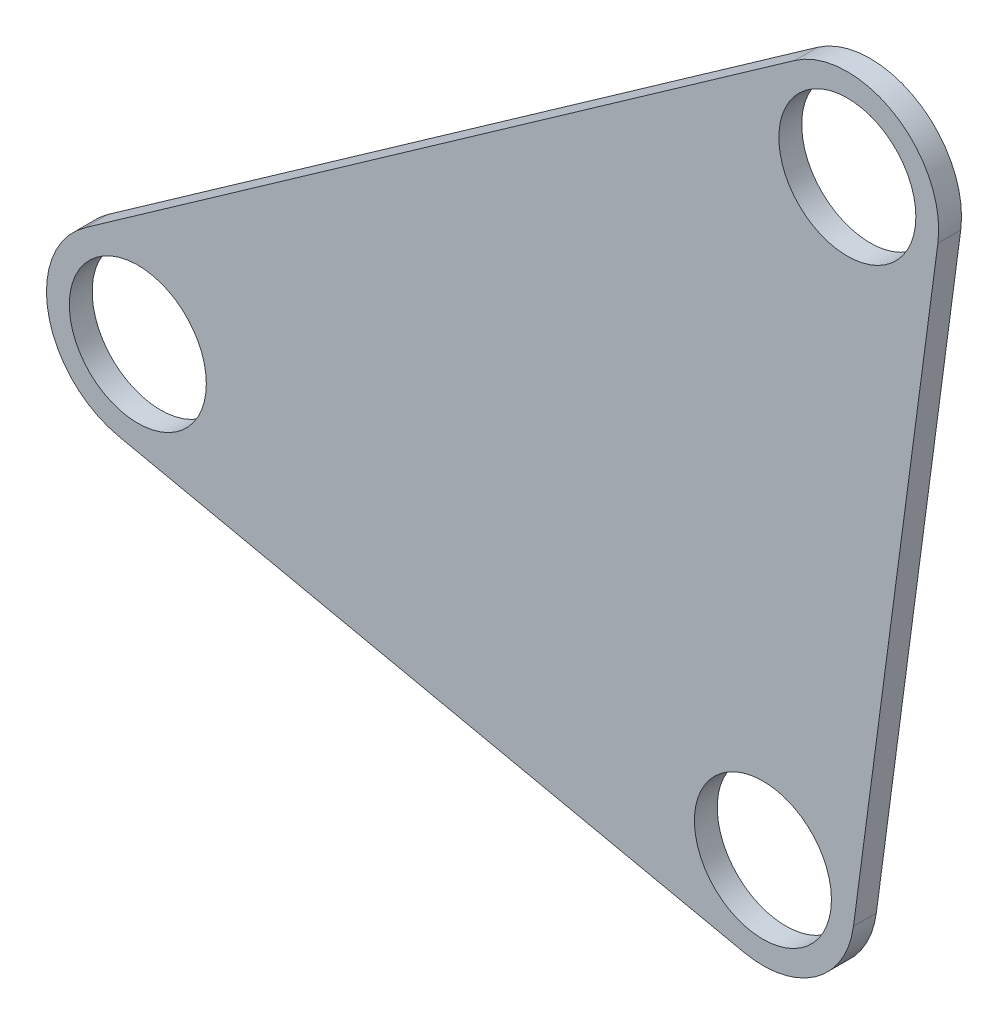
from build123d import *

# Parameters (mm, degrees)
ESQUISSE1_R               = 3
T_LE_DE_BASE_PLI_E1_DEPTH = 1


# Sheet-metal steps are written as plain solids
with BuildPart() as part:
    # Esquisse1 → Tôle de base pliée1 (new body)
    with BuildSketch(Plane.XY):
        with BuildLine():
            Line((-59.980728888, -3.900810235), (-32.6051263, -9.780978848))
            ThreePointArc((-32.6051263, -9.780978848), (-29.46250107, -9.14096248), (-27.800119432, -6.398299253))
            Line((-27.800119432, -6.398299253), (-24.103274011, 21.356580209))
            ThreePointArc((-24.103274011, 21.356580209), (-25.994902612, 25.305403023), (-30.370857933, 25.155484984))
            Line((-30.370857933, 25.155484984), (-61.443305942, 3.280774136))
            ThreePointArc((-61.443305942, 3.280774136), (-63.060247102, -0.788250523), (-59.980728888, -3.900810235))
        make_face()
        with Locations((-28.068256791, 21.884700983)):
            Circle(ESQUISSE1_R, mode=Mode.SUBTRACT)
        with Locations((-31.765102212, -5.870178479)):
            Circle(ESQUISSE1_R, mode=Mode.SUBTRACT)
        with Locations((-59.1407048, 0.009990135)):
            Circle(ESQUISSE1_R, mode=Mode.SUBTRACT)
    extrude(amount=T_LE_DE_BASE_PLI_E1_DEPTH)


solid = part.part
